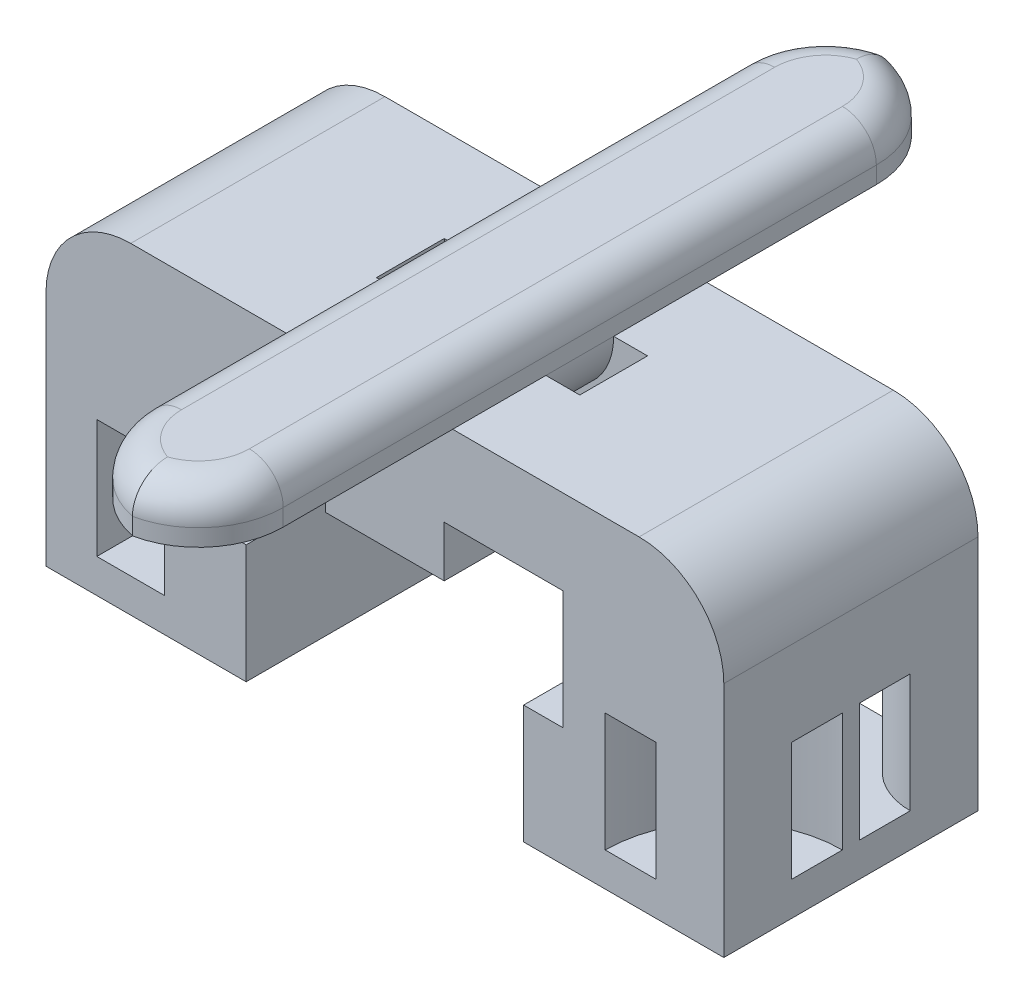
from build123d import *

# Parameters (mm, degrees)
BOSS_EXTRUDE3_DEPTH = 15
SKETCH7_W           = 8
SKETCH7_H           = 45
BOSS_EXTRUDE5_DEPTH = 3
FILLET2_R           = 5
FILLET3_R           = 5
FILLET4_R           = 2
SKETCH20_W          = 3
SKETCH20_H          = 7
CUT_REVOLVE10_ANGLE = 90
SKETCH22_W          = 2
SKETCH22_H          = 4
CUT_REVOLVE12_ANGLE = 180
SKETCH23_W          = 3
SKETCH23_H          = 7
CUT_REVOLVE13_ANGLE = 90
CUT_EXTRUDE7_DEPTH  = 1.5
CUT_EXTRUDE8_REACH  = 47.963
SKETCH25_W          = 4
SKETCH25_H          = 7


# Some blends are built 0.0001 mm under size
with BuildPart() as part:
    # Sketch1 → Boss-Extrude3 (new body)
    with BuildSketch(Plane.XY):
        Polygon((-9.5, -5.016557179), (2.3125, -5.016557179), (2.3125, 1.983442821), (0, 1.983442821), (0, 8.983442821), (7, 8.983442821), (7, 5.983442821), (14, 5.983442821), (14, 8.983442821), (21, 8.983442821), (21, 1.983442821), (18.6875, 1.983442821), (18.6875, -5.016557179), (30.5, -5.016557179), (30.5, 4.175991076), (30.5, 13.983442821), (-9.5, 13.983442821), align=None)
    extrude(amount=BOSS_EXTRUDE3_DEPTH)

    # Sketch7 → Boss-Extrude5 (add)
    with BuildSketch(Plane(origin=(0, 13.983442821, 0), x_dir=(1, 0, 0), z_dir=(0, 1, 0))):
        with Locations((10.5, -7.5)):
            Rectangle(SKETCH7_W, SKETCH7_H)
    extrude(amount=BOSS_EXTRUDE5_DEPTH)

    # Fillet2
    # the kernel refuses this fillet: 5 mm, written as the material it takes off along each edge
    with BuildSketch(Plane(origin=(14.5, 1.483442821, -15), x_dir=(0, 0, 1), z_dir=(0, 1, 0)), Plane(origin=(6.5, 1.483442821, 30), x_dir=(0, 0, -1), z_dir=(0, 1, 0))) as fillet2_piece_1:
        with BuildLine():
            CenterArc((FILLET2_R, -FILLET2_R), FILLET2_R, 90, 90)
            Line((0, -FILLET2_R), (0, 0))
            Line((0, 0), (FILLET2_R, 0))
        make_face()
    extrude(amount=28, mode=Mode.SUBTRACT)
    with BuildSketch(Plane(origin=(6.5, 1.483442821, -15), x_dir=(0, 0, 1), z_dir=(0, 1, 0)), Plane(origin=(14.5, 1.483442821, 30), x_dir=(0, 0, -1), z_dir=(0, 1, 0))) as fillet2_piece_2:
        with BuildLine():
            CenterArc((FILLET2_R, FILLET2_R), FILLET2_R, 180, 90)
            Line((0, FILLET2_R), (0, 0))
            Line((0, 0), (FILLET2_R, 0))
        make_face()
    extrude(amount=28, mode=Mode.SUBTRACT)

    # Fillet3
    fillet3_edges = [part.edges().sort_by_distance(p)[0] for p in [
        (-9.5, 13.983442821, 7.5),
        (30.5, 13.983442821, 7.5),
    ]]
    fillet(fillet3_edges, radius=FILLET3_R)

    # Fillet4
    fillet4_edges = [part.edges().sort_by_distance(p)[0] for p in [
        (14.5, 16.983442821, 7.5),
        (6.5, 16.983442821, 7.5),
        (13.372983346, 16.983442821, 28.16227766),
        (7.627016654, 16.983442821, 28.16227766),
        (7.627016654, 16.983442821, -13.16227766),
        (13.372983346, 16.983442821, -13.16227766),
    ]]
    fillet(fillet4_edges, radius=FILLET4_R - 0.0001)  # a hair under: the kernel refuses the full size

    # Sketch20 → Cut-Revolve10 (revolve, cut)
    with BuildSketch(Plane(origin=(30.5, 0, 0), x_dir=(0, 0, -1), z_dir=(1, 0, 0))):
        with Locations((-9.5, 0.483442821)):
            Rectangle(SKETCH20_W, SKETCH20_H)
    revolve(axis=Axis((30.5, 4.175991076, 15), (0, 1, 0)), revolution_arc=CUT_REVOLVE10_ANGLE, mode=Mode.SUBTRACT)

    # Sketch22 → Cut-Revolve12 (revolve, cut)
    with BuildSketch(Plane(origin=(0, 13.983442821, 0), x_dir=(1, 0, 0), z_dir=(0, 1, 0))):
        with Locations((5.5, -7.5)):
            Rectangle(SKETCH22_W, SKETCH22_H)
    revolve(axis=Axis((10.5, 13.983442821, -12.828427125), (0, 0, 1)), revolution_arc=CUT_REVOLVE12_ANGLE, mode=Mode.SUBTRACT)

    # Sketch23 → Cut-Revolve13 (revolve, cut)
    with BuildSketch(Plane(origin=(0, 0, 0), x_dir=(-1, 0, 0), z_dir=(0, 0, -1))):
        with Locations((-25, 0.483442821)):
            Rectangle(SKETCH23_W, SKETCH23_H)
    revolve(axis=Axis((30.5, 4.175991076, 0), (0, 1, 0)), revolution_arc=CUT_REVOLVE13_ANGLE, mode=Mode.SUBTRACT)

    # Sketch24 → Cut-Extrude7 (cut)
    with BuildSketch(Plane.ZY.offset(9.5)):
        with BuildLine():
            add(Edge.make_bspline(
                [(9.539351852, -3.264242364), (9.384935117, -3.321057672), (9.069326633, -3.437181053), (8.572917933, -3.576058871), (8.047136914, -3.693430146), (7.492848955, -3.793266275), (6.908040042, -3.869241025), (6.293966869, -3.921105238), (5.650055356, -3.954268327), (5.210690045, -3.958724088), (4.986111111, -3.961001623)],
                knots=[0, 0, 0, 0, 0.852368475, 1.742134509, 2.668522204, 3.643446598, 4.659675139, 5.723264927, 6.836260576, 8, 8, 8, 8], degree=3))
            add(Edge.make_bspline(
                [(4.986111111, -3.961001623), (4.909830484, -3.956133253), (4.758204448, -3.946456201), (4.539100237, -3.866324588), (4.332889407, -3.74182716), (4.147582505, -3.57161972), (3.991428534, -3.375933838), (3.87456572, -3.165908821), (3.800689936, -2.948115815), (3.791553424, -2.798733577), (3.787037037, -2.724890512)],
                knots=[0, 0, 0, 0, 0.967903344, 1.923939954, 2.932206029, 4.016300428, 5.106155435, 6.103325225, 7.062430174, 8, 8, 8, 8], degree=3))
            Line((3.787037037, -2.724890512), (3.787037037, 5.615387266))
            add(Edge.make_bspline(
                [(3.787037037, 5.615387266), (3.778747396, 5.79437856), (3.762207716, 6.151506038), (3.752518295, 6.508884933), (3.747685185, 6.687146525)],
                knots=[0, 0, 0, 0, 1.002394409, 2, 2, 2, 2], degree=3))
            add(Edge.make_bspline(
                [(3.747685185, 6.687146525), (3.744517659, 6.784358746), (3.738459519, 6.970284682), (3.743212943, 7.238305354), (3.758346621, 7.48249507), (3.77781419, 7.637066008), (3.787037037, 7.710294673)],
                knots=[0, 0, 0, 0, 1.138228833, 2.176951195, 3.136322568, 4, 4, 4, 4], degree=3))
            add(Edge.make_bspline(
                [(3.787037037, 7.710294673), (3.798871378, 7.769835974), (3.82225904, 7.887504698), (3.907498607, 8.049127603), (4.028486342, 8.189268469), (4.183536918, 8.311576021), (4.373172176, 8.416222501), (4.600630549, 8.496546771), (4.86067942, 8.564727705), (5.04746263, 8.591845977), (5.145833333, 8.606128007)],
                knots=[0, 0, 0, 0, 0.827508127, 1.635366103, 2.467177893, 3.346462533, 4.325252814, 5.418170721, 6.640261294, 8, 8, 8, 8], degree=3))
            add(Edge.make_bspline(
                [(5.145833333, 8.606128007), (5.198883578, 8.620844864), (5.31248671, 8.652359914), (5.497921205, 8.684468606), (5.706143181, 8.715495822), (5.938796954, 8.737317874), (6.195793386, 8.755910819), (6.477521717, 8.769165307), (6.783107226, 8.779208045), (6.994589359, 8.779557863), (7.104166667, 8.779739118)],
                knots=[0, 0, 0, 0, 0.669856344, 1.434447267, 2.288653413, 3.232707514, 4.278111621, 5.425526845, 6.666063029, 8, 8, 8, 8], degree=3))
            add(Edge.make_bspline(
                [(7.104166667, 8.779739118), (7.226212189, 8.777251421), (7.469561384, 8.77229115), (7.831960974, 8.726563211), (8.190354574, 8.652296857), (8.543933883, 8.547903032), (8.894226874, 8.414283932), (9.240706559, 8.253073799), (9.582548325, 8.059486733), (9.802601615, 7.912336948), (9.914351852, 7.837609488)],
                knots=[0, 0, 0, 0, 0.972237292, 1.938564864, 2.905733309, 3.886373309, 4.873067234, 5.890902636, 6.928931576, 8, 8, 8, 8], degree=3))
            add(Edge.make_bspline(
                [(9.914351852, 7.837609488), (10.039992978, 7.746173989), (10.284020914, 7.568582329), (10.604431612, 7.264470853), (10.878028037, 6.946462237), (11.103739851, 6.611157965), (11.275985863, 6.256144084), (11.399703436, 5.884324713), (11.476067989, 5.495036954), (11.485809195, 5.229157213), (11.490740741, 5.094553933)],
                knots=[0, 0, 0, 0, 1.129527738, 2.193838357, 3.205222337, 4.176778936, 5.125822842, 6.066695963, 7.021252752, 8, 8, 8, 8], degree=3))
            add(Edge.make_bspline(
                [(11.490740741, 5.094553933), (11.486767803, 4.952357602), (11.479085968, 4.677415291), (11.419604813, 4.282227488), (11.317023096, 3.92014682), (11.212888075, 3.701381195), (11.162037037, 3.594553933)],
                knots=[0, 0, 0, 0, 1.100229526, 2.127337947, 3.085544813, 4, 4, 4, 4], degree=3))
            add(Edge.make_bspline(
                [(11.162037037, 3.594553933), (11.112944227, 3.510003001), (11.008536691, 3.33018534), (10.803461805, 3.071153663), (10.554576678, 2.800773305), (10.364144805, 2.627766023), (10.263888889, 2.536683562)],
                knots=[0, 0, 0, 0, 0.84037168, 1.787250221, 2.83506236, 4, 4, 4, 4], degree=3))
            add(Edge.make_bspline(
                [(10.263888889, 2.536683562), (10.388526562, 2.468778399), (10.639635184, 2.331969266), (10.985581958, 2.066657323), (11.31321177, 1.758965511), (11.50427793, 1.5214197), (11.601851852, 1.400109488)],
                knots=[0, 0, 0, 0, 0.960844711, 1.935822328, 2.945862986, 4, 4, 4, 4], degree=3))
            add(Edge.make_bspline(
                [(11.601851852, 1.400109488), (11.652206468, 1.329773766), (11.750335893, 1.192705817), (11.878572693, 0.979859693), (11.987376649, 0.768121977), (12.076289488, 0.555256909), (12.146205707, 0.343351675), (12.194426097, 0.130915025), (12.226715541, -0.080377178), (12.22989768, -0.221687659), (12.231481481, -0.292020142)],
                knots=[0, 0, 0, 0, 1.129897481, 2.201907172, 3.243474804, 4.237709754, 5.213316789, 6.154886028, 7.081657326, 8, 8, 8, 8], degree=3))
            add(Edge.make_bspline(
                [(12.231481481, -0.292020142), (12.227474765, -0.38019309), (12.219431836, -0.557188107), (12.167698239, -0.820868), (12.077549835, -1.079864068), (11.954275261, -1.335568251), (11.7943391, -1.586690035), (11.601537176, -1.835508515), (11.370708453, -2.07814489), (11.199418813, -2.231484847), (11.111111111, -2.31053866)],
                knots=[0, 0, 0, 0, 0.887823576, 1.782183199, 2.693654907, 3.642246656, 4.633738087, 5.685775221, 6.806910495, 8, 8, 8, 8], degree=3))
            add(Edge.make_bspline(
                [(11.111111111, -2.31053866), (10.986227411, -2.411565303), (10.740470299, -2.610374404), (10.348794006, -2.865355541), (9.952829245, -3.090730843), (9.676440085, -3.206714702), (9.539351852, -3.264242364)],
                knots=[0, 0, 0, 0, 1.043422909, 2.053339237, 3.034461826, 4, 4, 4, 4], degree=3))
        make_face()
        with BuildLine():
            add(Edge.make_bspline(
                [(7.053240741, 6.721868747), (6.974537452, 6.721794135), (6.825618484, 6.721652957), (6.614188755, 6.722590278), (6.428238067, 6.719631514), (6.266974919, 6.717398649), (6.130390065, 6.715256687), (6.018531977, 6.712550675), (5.931222393, 6.711585336), (5.881933408, 6.707423307), (5.861111111, 6.705665044)],
                knots=[0, 0, 0, 0, 1.584098203, 2.997362286, 4.255418487, 5.327126863, 6.243550564, 7.004697374, 7.579531063, 8, 8, 8, 8], degree=3))
            Line((5.861111111, 6.705665044), (5.861111111, 5.06909097))
            Line((5.861111111, 5.06909097), (5.861111111, 3.446405784))
            add(Edge.make_bspline(
                [(5.861111111, 3.446405784), (5.970586456, 3.433039412), (6.174544668, 3.408137172), (6.459551396, 3.388284971), (6.701494365, 3.377497265), (6.848010084, 3.386688481), (6.914351852, 3.390850229)],
                knots=[0, 0, 0, 0, 1.252497411, 2.333467246, 3.245400222, 4, 4, 4, 4], degree=3))
            add(Edge.make_bspline(
                [(6.914351852, 3.390850229), (7.009366949, 3.39912298), (7.193758353, 3.415177526), (7.461112771, 3.45487831), (7.709820605, 3.50549298), (7.940676847, 3.564911344), (8.152591418, 3.637083194), (8.346462493, 3.719230059), (8.521567567, 3.813270136), (8.680291312, 3.913328309), (8.81820433, 4.02897459), (8.939544827, 4.1538434), (9.042174478, 4.290456554), (9.12296187, 4.438666165), (9.189854564, 4.595452), (9.23475351, 4.764611703), (9.263539547, 4.943878653), (9.266836957, 5.066661348), (9.268518519, 5.129276155)],
                knots=[0, 0, 0, 0, 1.401783243, 2.720375878, 3.970551655, 5.131564862, 6.222004602, 7.25861111, 8.222745589, 9.141439013, 10.011362784, 10.861691501, 11.696521614, 12.513987543, 13.337646782, 14.196181969, 15.080116965, 16, 16, 16, 16], degree=3))
            add(Edge.make_bspline(
                [(9.268518519, 5.129276155), (9.26614904, 5.175000929), (9.261391906, 5.266801263), (9.226690681, 5.403094602), (9.173229013, 5.538996666), (9.095653244, 5.672929086), (8.997577666, 5.805439914), (8.877598094, 5.935884613), (8.736703426, 6.065300952), (8.631100369, 6.145563573), (8.576388889, 6.187146525)],
                knots=[0, 0, 0, 0, 0.836354472, 1.679125168, 2.56043097, 3.502994811, 4.503071443, 5.572931202, 6.74256929, 8, 8, 8, 8], degree=3))
            add(Edge.make_bspline(
                [(8.576388889, 6.187146525), (8.457637368, 6.269260303), (8.226115178, 6.429352247), (7.844542661, 6.595096659), (7.453667507, 6.704682822), (7.186682735, 6.716141547), (7.053240741, 6.721868747)],
                knots=[0, 0, 0, 0, 1.052870391, 2.052713583, 3.026724327, 4, 4, 4, 4], degree=3))
        make_face(mode=Mode.SUBTRACT)
        with BuildLine():
            add(Edge.make_bspline(
                [(7.997685185, 1.166313192), (7.934409785, 1.165963836), (7.800125698, 1.165222428), (7.587970613, 1.171511049), (7.354176433, 1.175935915), (7.098698605, 1.179181145), (6.821014736, 1.190374611), (6.520798258, 1.198401965), (6.198275508, 1.210388315), (5.976077035, 1.219479675), (5.861111111, 1.224183562)],
                knots=[0, 0, 0, 0, 0.71041914, 1.507663079, 2.382863073, 3.336021866, 4.376237049, 5.503044317, 6.708070249, 8, 8, 8, 8], degree=3))
            Line((5.861111111, 1.224183562), (5.861111111, -1.886927549))
            add(Edge.make_bspline(
                [(5.861111111, -1.886927549), (6.091383526, -1.869110075), (6.563827297, -1.832554438), (7.283377216, -1.717850123), (8.031763629, -1.556403432), (8.533943611, -1.412281199), (8.791666667, -1.338316438)],
                knots=[0, 0, 0, 0, 0.927221467, 1.902355547, 2.92347095, 4, 4, 4, 4], degree=3))
            add(Edge.make_bspline(
                [(8.791666667, -1.338316438), (8.900226167, -1.305140449), (9.103925311, -1.242889605), (9.382584878, -1.132322431), (9.620433439, -1.025039121), (9.815876338, -0.916076144), (9.968440087, -0.802932497), (10.074976026, -0.686151908), (10.147449563, -0.566373084), (10.154174412, -0.481142972), (10.157407407, -0.44016829)],
                knots=[0, 0, 0, 0, 1.584866065, 2.97381491, 4.184200394, 5.22688373, 6.095585971, 6.820562255, 7.432981079, 8, 8, 8, 8], degree=3))
            add(Edge.make_bspline(
                [(10.157407407, -0.44016829), (10.153139532, -0.387377372), (10.144513249, -0.280675698), (10.096110243, -0.125115055), (10.022317338, 0.025393054), (9.924972433, 0.171632645), (9.799144159, 0.311925683), (9.648137785, 0.447684929), (9.471130218, 0.580866357), (9.339535145, 0.659817439), (9.270833333, 0.701035414)],
                knots=[0, 0, 0, 0, 0.840324838, 1.698475254, 2.571245387, 3.500520635, 4.483056778, 5.560434277, 6.726376431, 8, 8, 8, 8], degree=3))
            add(Edge.make_bspline(
                [(9.270833333, 0.701035414), (9.160813998, 0.762664639), (8.949056311, 0.881284353), (8.623769949, 1.017848161), (8.309880461, 1.120180447), (8.099371579, 1.151287108), (7.997685185, 1.166313192)],
                knots=[0, 0, 0, 0, 1.107757376, 2.132135575, 3.097727392, 4, 4, 4, 4], degree=3))
        make_face(mode=Mode.SUBTRACT)
    extrude(amount=-CUT_EXTRUDE7_DEPTH, mode=Mode.SUBTRACT)

    # Sketch25 → Cut-Extrude8 (cut, up to next)
    with BuildSketch(Plane(origin=(0, 0, 0), x_dir=(-1, 0, 0), z_dir=(0, 0, -1)), mode=Mode.PRIVATE) as cut_extrude8_sk1:
        with Locations((4.5, 0.483442821)):
            Rectangle(SKETCH25_W, SKETCH25_H)
    cut_extrude8_tool1 = extrude(cut_extrude8_sk1.sketch, amount=-CUT_EXTRUDE8_REACH, mode=Mode.PRIVATE) & part.part
    add(cut_extrude8_tool1.solids().sort_by_distance((-4.5, 0.483443, 0))[0], mode=Mode.SUBTRACT)


solid = part.part
